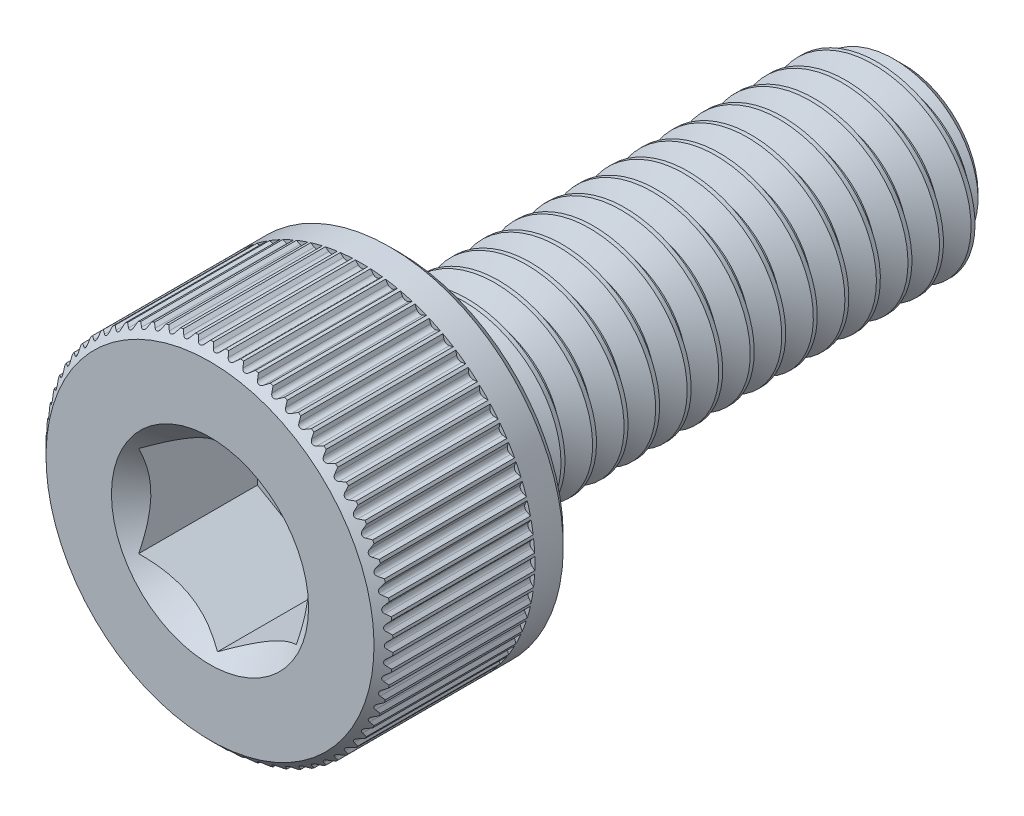
from build123d import *

# Parameters (mm, degrees)
CUT_EXTRUDE1_DEPTH     = 2
SKETCH4_R              = 1.5625
CUT_EXTRUDE2_DEPTH     = 1.5
CUT_EXTRUDE2_DRAFT     = -45
SPLIT1_SURFACE_1_BACK  = 14.472
SPLIT1_SURFACE_1_DEPTH = 28.944
SPLIT1_SURFACE_2_BACK  = 14.472
SPLIT1_SURFACE_2_DEPTH = 28.944
CUT_SWEEP1_PITCH       = 0.5
CUT_EXTRUDE3_DEPTH     = 2.4
CIRPATTERN1_COUNT      = 72


with BuildPart() as part:
    # Sketch2 → Revolve1 (revolve)
    with BuildSketch(Plane(origin=(0, 0, 0), x_dir=(0, 0, -1), z_dir=(1, 0, 0))):
        with BuildLine():
            Line((-5.5, 0), (-5.5, 2.6))
            Line((-5.5, 2.6), (-5.35, 2.75))
            Line((-5.35, 2.75), (-2.65, 2.75))
            Line((-2.65, 2.75), (-2.5, 2.6))
            Line((-2.5, 2.6), (-2.5, 1.65))
            ThreePointArc((-2.5, 1.65), (-2.456066017, 1.543933983), (-2.35, 1.5))
            Line((-2.35, 1.5), (5.175240474, 1.5))
            Line((5.175240474, 1.5), (5.5, 1.175240474))
            Line((5.5, 1.175240474), (5.5, 0))
            Line((5.5, 0), (-5.5, 0))
        make_face()
    revolve(axis=Axis((0, 0, -5.5), (0, 0, 1)))

    # Sketch3 → Cut-Extrude1 (cut)
    with BuildSketch(Plane.XY.offset(5.5)):
        Polygon((1.25, -0.721687836), (1.25, 0.721687836), (0, 1.443375673), (-1.25, 0.721687836), (-1.25, -0.721687836), (0, -1.443375673), align=None)
    extrude(amount=-CUT_EXTRUDE1_DEPTH, mode=Mode.SUBTRACT)


with BuildPart() as cut_extrude2_tool:
    # Sketch4 → Cut-Extrude2 (with draft: the straight prism first)
    with BuildSketch(Plane.XY.offset(5.5)):
        Circle(SKETCH4_R)
    extrude(amount=-CUT_EXTRUDE2_DEPTH)
    # Cut-Extrude2: the draft: its side faces are tilted about the plane it starts from
    cut_extrude2_sides = [cut_extrude2_tool.faces().sort_by_distance(p)[0] for p in [
        (-1.5625, 0, 4.75),
    ]]
    draft(cut_extrude2_sides, Plane.XY.offset(5.5), CUT_EXTRUDE2_DRAFT)


with BuildPart() as part_1:
    add(part.part)

    # Cut-Extrude2: cut by cut_extrude2_tool
    add(cut_extrude2_tool.part, mode=Mode.SUBTRACT)


with BuildPart() as body_2:
    # Split1: the piece behind the surface
    add(part_1.part)
    # Split1 surface: a surface, the sketch's curves swept straight by 28.944 mm
    with BuildLine(Plane(origin=(0, 0, 0), x_dir=(0, 0, -1), z_dir=(1, 0, 0)).offset(-SPLIT1_SURFACE_1_BACK), mode=Mode.PRIVATE) as split1_surface_1_path:
        Line((-2.35, -2.75), (-2.35, 2.75))
    split1_surface_1 = Shell.extrude(split1_surface_1_path.wire(), (1 * SPLIT1_SURFACE_1_DEPTH, 0 * SPLIT1_SURFACE_1_DEPTH, 0 * SPLIT1_SURFACE_1_DEPTH))
    split(bisect_by=split1_surface_1, keep=Keep.BOTTOM)

    # Cut-Sweep1: the profile of Sketch7 screwed along a right-hand helix of 17 turns, 6 arcs to a turn; built about Z, then put on its axis
    cut_sweep1_z = Axis((0, 0, 0), (0, 0, 1))
    cut_sweep1_corners = [(1.527063294, 0, 0.015625), (1.527063294, 0, -0.453125), (1.175240474, 0, -0.25), (1.175240474, 0, -0.1875)]
    with BuildLine(mode=Mode.PRIVATE) as cut_sweep1_profile:
        Line(cut_sweep1_corners[0], cut_sweep1_corners[1])
        Line(cut_sweep1_corners[1], cut_sweep1_corners[2])
        Line(cut_sweep1_corners[2], cut_sweep1_corners[3])
        Line(cut_sweep1_corners[3], cut_sweep1_corners[0])
    cut_sweep1_cap = Face(cut_sweep1_profile.wire())
    cut_sweep1_turn_angles = [0, 30, 60, 90, 120, 150, 180, 210, 240, 270, 300, 330, 360]
    cut_sweep1_turn_weights = [1, 0.8660254037844387, 1, 0.8660254037844387, 1, 0.8660254037844387, 1, 0.8660254037844387, 1, 0.8660254037844387, 1, 0.8660254037844387, 1]
    cut_sweep1_turn_rails = [Edge.make_bspline([Vector(p[0], p[1], 0).rotate(cut_sweep1_z, cut_sweep1_turn_angles[k]) / cut_sweep1_turn_weights[k] + Vector(0, 0, p[2] + CUT_SWEEP1_PITCH * cut_sweep1_turn_angles[k] / 360) for k in range(13)], [0, 0, 0, 1, 1, 2, 2, 3, 3, 4, 4, 5, 5, 6, 6, 6], 2, cut_sweep1_turn_weights) for p in cut_sweep1_corners]
    cut_sweep1_turn_sides = [Face.make_surface_from_curves(cut_sweep1_turn_rails[p[0]], cut_sweep1_turn_rails[p[1]]) for p in [(0, 1), (1, 2), (2, 3), (3, 0)]]
    cut_sweep1 = Plane(origin=(0, 0, -5.5), x_dir=(0, 1, 0), z_dir=(0, 0, 1)) * Solid(Shell([*[p.moved(Location((0, 0, CUT_SWEEP1_PITCH * i))) for i in range(17) for p in cut_sweep1_turn_sides], cut_sweep1_cap, cut_sweep1_cap.rotate(cut_sweep1_z, 6120).moved(Location((0, 0, CUT_SWEEP1_PITCH * 6120 / 360)))]))
    add(cut_sweep1, mode=Mode.SUBTRACT)


with BuildPart() as part_2:
    add(part_1.part)

    # Split1: split by a surface, the side it looks to stays
    # Split1 surface: a surface, the sketch's curves swept straight by 28.944 mm
    with BuildLine(Plane(origin=(0, 0, 0), x_dir=(0, 0, -1), z_dir=(1, 0, 0)).offset(-SPLIT1_SURFACE_2_BACK), mode=Mode.PRIVATE) as split1_surface_2_path:
        Line((-2.35, -2.75), (-2.35, 2.75))
    split1_surface_2 = Shell.extrude(split1_surface_2_path.wire(), (1 * SPLIT1_SURFACE_2_DEPTH, 0 * SPLIT1_SURFACE_2_DEPTH, 0 * SPLIT1_SURFACE_2_DEPTH))
    split(bisect_by=split1_surface_2, keep=Keep.TOP)

    add(body_2.part)  # Revolve2 merges body 2
    # Sketch8 → Revolve2 (revolve)
    with BuildSketch(Plane(origin=(0, 0, 0), x_dir=(0, 0, -1), z_dir=(1, 0, 0))):
        Polygon((-2.5, 0), (-2.5, 1.5), (-2.35, 1.5), (-1.483974596, 0), align=None)
    revolve(axis=Axis((0, 0, 1.483974596), (0, 0, 1)))

    # Sketch12 → Cut-Extrude3 (cut)
    with BuildSketch(Plane.XY.offset(5.5)):
        with BuildLine():
            Line((-0.166398842, 2.81875), (0.166398842, 2.81875))
            Line((0.166398842, 2.81875), (0.049333409, 2.701684567))
            ThreePointArc((0.049333409, 2.701684567), (0, 2.68125), (-0.049333409, 2.701684567))
            Line((-0.049333409, 2.701684567), (-0.166398842, 2.81875))
        make_face()
    cut_extrude3 = extrude(amount=-CUT_EXTRUDE3_DEPTH, mode=Mode.SUBTRACT)

    # CirPattern1: Cut-Extrude3 ×72 about axis
    cirpattern1_axis = Axis((0, 0, 0), (0, 0, 1))
    for i in range(1, CIRPATTERN1_COUNT):
        add(cut_extrude3.rotate(cirpattern1_axis, i * 360 / CIRPATTERN1_COUNT), mode=Mode.SUBTRACT)


solid = part_2.part
